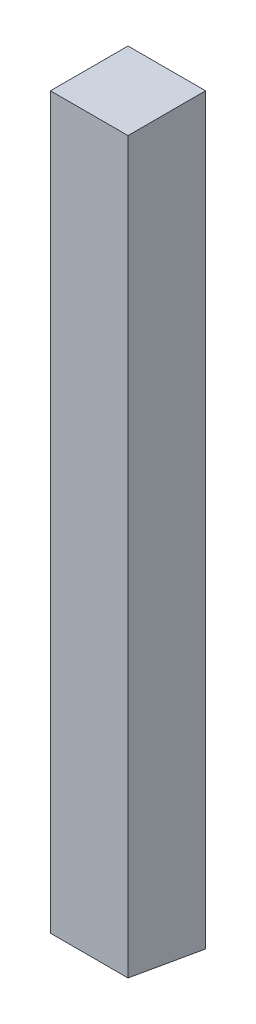
from build123d import *

# Parameters (mm, degrees)
SKETCH1_W           = 38.1
SKETCH1_H           = 38.1
BOSS_EXTRUDE1_DEPTH = 365
CUT_EXTRUDE1_REACH  = 369.477


with BuildPart() as part:
    # Sketch1 → Boss-Extrude1 (new body)
    with BuildSketch(Plane(origin=(0, 0, 0), x_dir=(1, 0, 0), z_dir=(0, 1, 0))):
        Rectangle(SKETCH1_W, SKETCH1_H)
    extrude(amount=BOSS_EXTRUDE1_DEPTH)

    # Sketch2 → Cut-Extrude1 (cut, up to next)
    with BuildSketch(Plane.ZY.offset(19.05), mode=Mode.PRIVATE) as cut_extrude1_sk1:
        Polygon((-19.05, 0), (19.05, 6.718057965), (19.05, 0), align=None)
    cut_extrude1_tool1 = extrude(cut_extrude1_sk1.sketch, amount=-CUT_EXTRUDE1_REACH, mode=Mode.PRIVATE) & part.part
    add(cut_extrude1_tool1.solids().sort_by_distance((-19.05, 2.239353, 6.35))[0], mode=Mode.SUBTRACT)


solid = part.part
